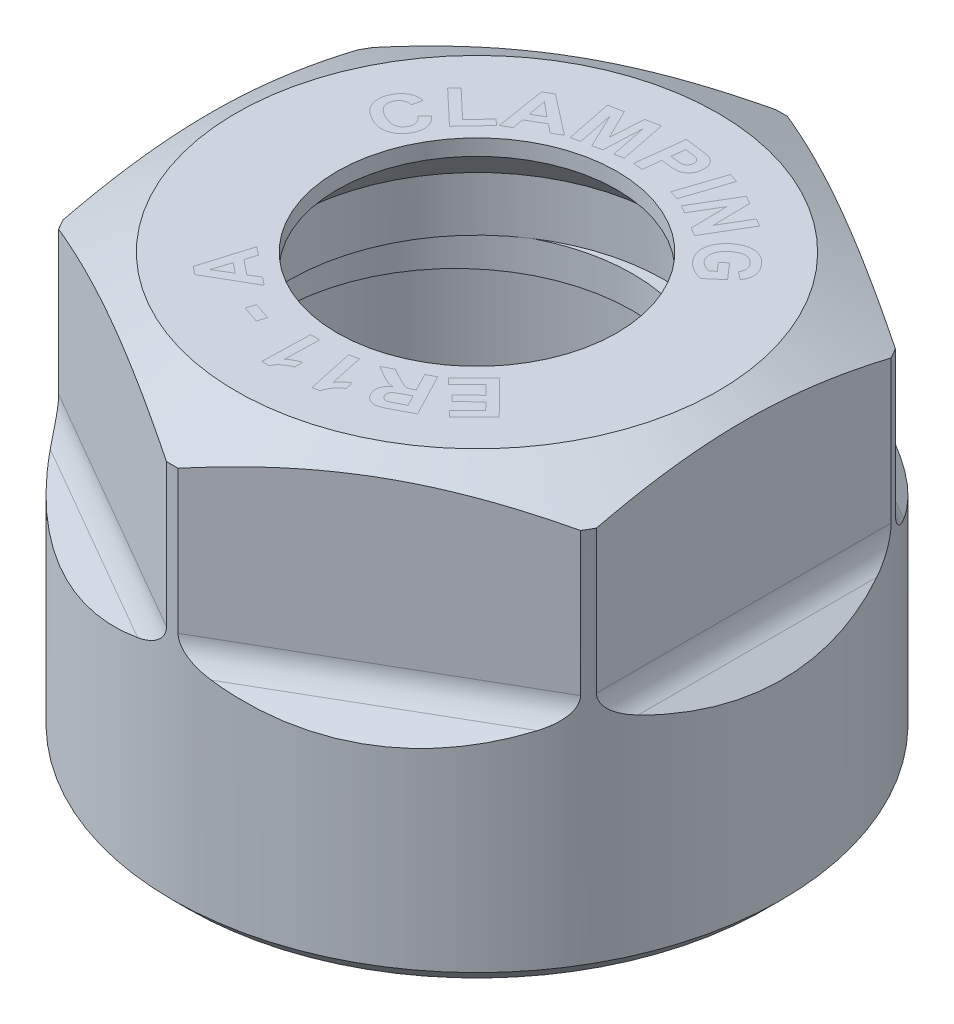
from build123d import *

# Parameters (mm, degrees)
ESBO_O1_R                = 9.55
ESBO_O1_R_2              = 4.385
RESSALTO_EXTRUS_O1_DEPTH = 6.65
CORTE_EXTRUS_O1_DEPTH    = 16.054152251
PADR_OCIRCULAR1_COUNT    = 3
PADR_OCIRCULAR1_ANGLE    = 120
CHANFRO1_SIZE            = 0.5
ESBO_O6_R                = 6.68
CORTE_EXTRUS_O2_DEPTH    = 8.6
ESBO_O7_R                = 5.55
CORTE_EXTRUS_O3_DEPTH    = 1


with BuildPart() as part:
    # Esboço1 → Ressalto-extrusão1 (new, symmetric)
    with BuildSketch(Plane(origin=(0, 0, 0), x_dir=(1, 0, 0), z_dir=(0, 1, 0))):
        Circle(ESBO_O1_R)
        Circle(ESBO_O1_R_2, mode=Mode.SUBTRACT)
    extrude(amount=RESSALTO_EXTRUS_O1_DEPTH, both=True)

    # Esboço3 → Corte-extrusão1 (cut, symmetric)
    with BuildSketch(Plane.XY):
        with BuildLine():
            Line((-8.36, 6.65), (-8.36, 1.170567051))
            ThreePointArc((-8.36, 1.170567051), (-8.472989167, 0.708818437), (-8.786423564, 0.351415006))
            Line((-8.786423564, 0.351415006), (-11.044154123, -1.229464951))
            Line((-11.044154123, -1.229464951), (-11.044154123, 6.65))
            Line((-11.044154123, 6.65), (-8.36, 6.65))
        make_face()
        with BuildLine():
            Line((11.044154123, 6.65), (11.044154123, -1.229464951))
            Line((11.044154123, -1.229464951), (8.786423564, 0.351415006))
            ThreePointArc((8.786423564, 0.351415006), (8.472989167, 0.708818437), (8.36, 1.170567051))
            Line((8.36, 1.170567051), (8.36, 6.65))
            Line((8.36, 6.65), (11.044154123, 6.65))
        make_face()
    corte_extrus_o1 = extrude(amount=CORTE_EXTRUS_O1_DEPTH, both=True, mode=Mode.SUBTRACT)

    # PadrãoCircular1: Corte-extrusão1 ×3 about axis
    padr_ocircular1_axis = Axis((0, 6.65, 0), (0, 1, 0))
    for i in range(1, PADR_OCIRCULAR1_COUNT):
        add(corte_extrus_o1.rotate(padr_ocircular1_axis, i * PADR_OCIRCULAR1_ANGLE / (PADR_OCIRCULAR1_COUNT - 1)), mode=Mode.SUBTRACT)

    # Esboço5 → Corte-Revolução1 (revolve, cut)
    with BuildSketch(Plane(origin=(0, 0, 0), x_dir=(0, 0, -1), z_dir=(1, 0, 0))):
        Polygon((-9.548267201, 6.65), (-7.548267201, 6.65), (-9.548267201, 5.65), (-10.170315626, 5.65), (-10.170315626, 6.65), align=None)
    revolve(axis=Axis((0, 0, 0), (0, 1, 0)), mode=Mode.SUBTRACT)

    # Chanfro1
    chanfro1_edges = [part.edges().sort_by_distance(p)[0] for p in [
        (-9.55, -6.65, 0),
    ]]
    chamfer(chanfro1_edges, length=CHANFRO1_SIZE)

    # Esboço6 → Corte-extrusão2 (cut)
    with BuildSketch(Plane.XZ.offset(6.65)):
        Circle(ESBO_O6_R)
    extrude(amount=-CORTE_EXTRUS_O2_DEPTH, mode=Mode.SUBTRACT)

    # Esboço7 → Corte-extrusão3 (cut)
    with BuildSketch(Plane.XZ.offset(-1.95)):
        with Locations((-0.665, 0)):
            Circle(ESBO_O7_R)
    extrude(amount=-CORTE_EXTRUS_O3_DEPTH, mode=Mode.SUBTRACT)

    # Esboço8 → Corte-Revolução2 (revolve, cut)
    with BuildSketch(Plane.XY):
        Polygon((-3.695429982, 6.65), (-4.385, 6.65), (-4.385, 6.15), (-5.885, 4.65), (-5.885, 2.95), (-3.695429982, 2.95), align=None)
    revolve(axis=Axis((0, 0, 0), (0, 1, 0)), mode=Mode.SUBTRACT)


solid = part.part
